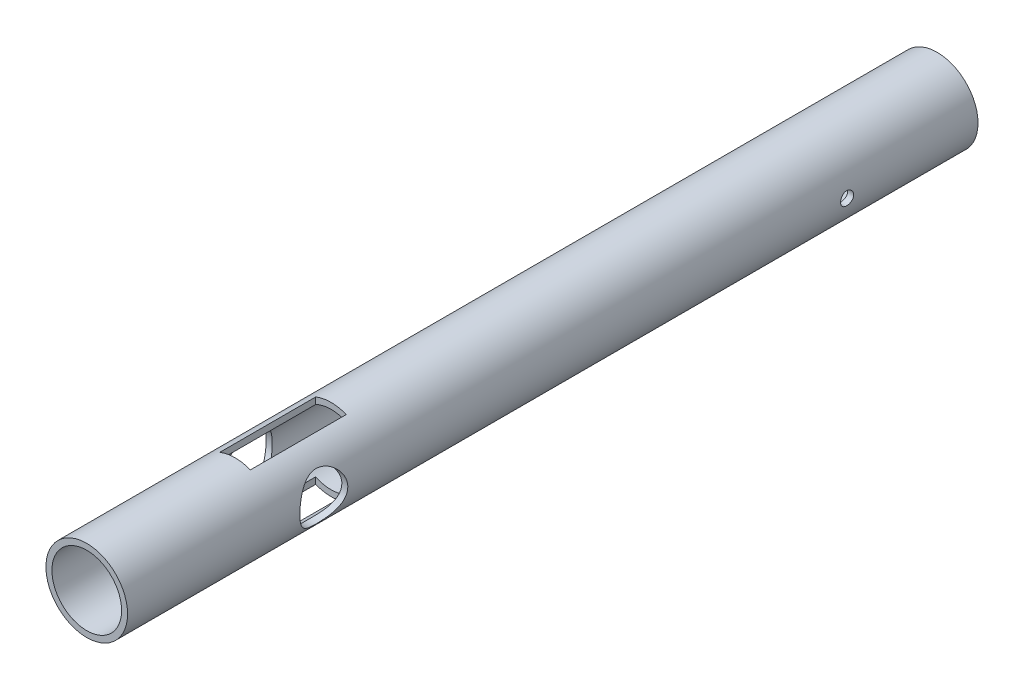
from build123d import *

# Parameters (mm, degrees)
SKETCH1_R           = 9.36
SKETCH1_R_2         = 7.99
EXTRUDE1_DEPTH      = 195
EXTRUDE2_DEPTH      = 196.448763618
EXTRUDE2_DEPTH_BACK = 196.448763618
SKETCH2_R           = 1.5
SKETCH2_R_2         = 5.5
EXTRUDE3_DEPTH      = 25
EXTRUDE3_DEPTH_BACK = 25
SKETCH3_W           = 7
SKETCH3_H           = 22


with BuildPart() as part:
    # Sketch1 → Extrude1 (new body)
    with BuildSketch(Plane.XY):
        Circle(SKETCH1_R)
        Circle(SKETCH1_R_2, mode=Mode.SUBTRACT)
    extrude(amount=EXTRUDE1_DEPTH)

    # Sketch2 → Extrude2 (cut, two sides: drawn at the far end of the back side and taken through both)
    with BuildSketch(Plane(origin=(0, 0, 0), x_dir=(0, 0, -1), z_dir=(1, 0, 0)).offset(-EXTRUDE2_DEPTH_BACK)):
        with Locations((-30, 0)):
            Circle(SKETCH2_R)
        with Locations((-150, 0)):
            Circle(SKETCH2_R_2)
    extrude(amount=EXTRUDE2_DEPTH + EXTRUDE2_DEPTH_BACK, mode=Mode.SUBTRACT)

    # Sketch3 → Extrude3 (cut, two sides: drawn at the far end of the back side and taken through both)
    with BuildSketch(Plane(origin=(0, 0, 0), x_dir=(1, 0, 0), z_dir=(0, 1, 0)).offset(-EXTRUDE3_DEPTH_BACK)):
        with Locations((0, -150)):
            Rectangle(SKETCH3_W, SKETCH3_H)
    extrude(amount=EXTRUDE3_DEPTH + EXTRUDE3_DEPTH_BACK, mode=Mode.SUBTRACT)


solid = part.part
